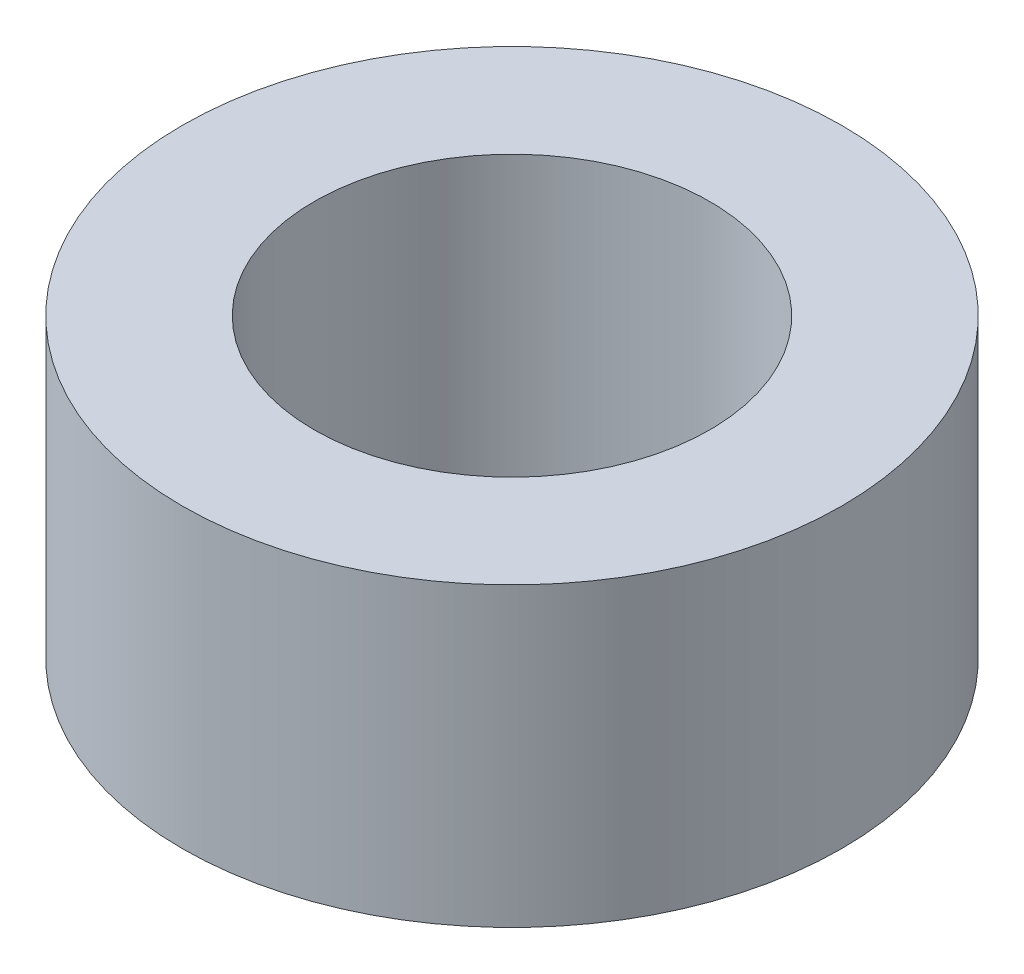
from build123d import *

# Parameters (mm, degrees)
SKETCH1_R           = 7.9375
SKETCH1_R_2         = 4.7625
BOSS_EXTRUDE1_DEPTH = 7.14375


with BuildPart() as part:
    # Sketch1 → Boss-Extrude1 (new body)
    with BuildSketch(Plane(origin=(0, 0, 0), x_dir=(1, 0, 0), z_dir=(0, 1, 0))):
        Circle(SKETCH1_R)
        Circle(SKETCH1_R_2, mode=Mode.SUBTRACT)
    extrude(amount=BOSS_EXTRUDE1_DEPTH)


solid = part.part
